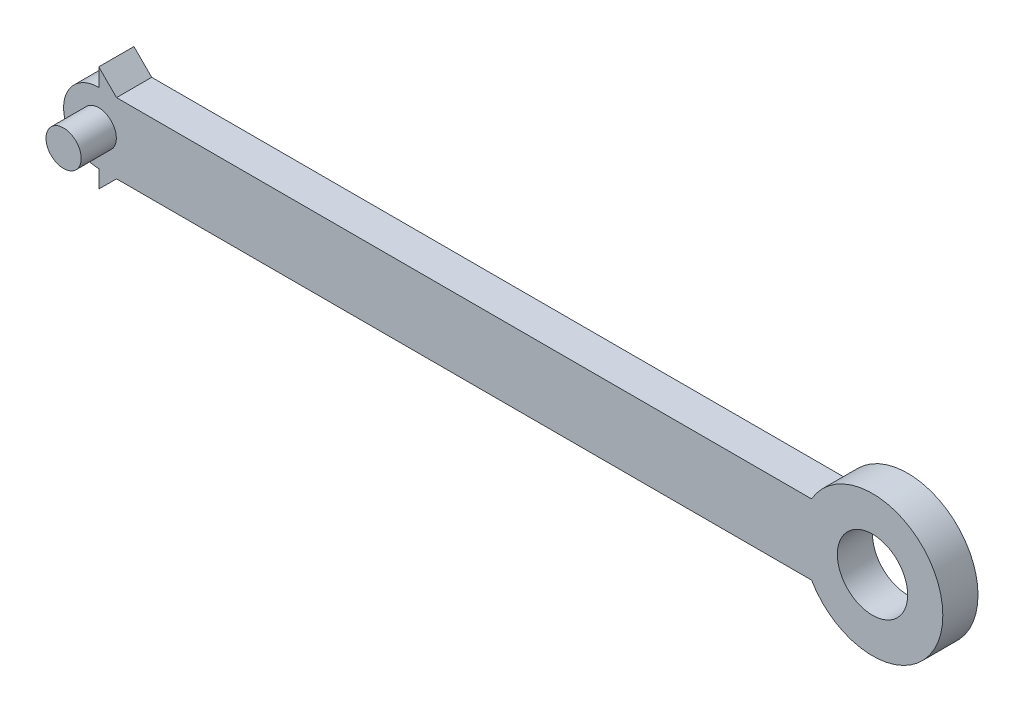
from build123d import *

# Parameters (mm, degrees)
BOSS_EXTRUDE1_DEPTH    = 20
SKETCH2_R              = 10
CUT_EXTRUDE1_DEPTH     = 20
SPUR_START             = 143.992112376
SPUR_GEAR_AM_OUTLINE_R = 5
SPUR_GEAR_AM_DEPTH     = 10
SKETCH4_R              = 40
BOSS_EXTRUDE2_DEPTH    = 20
BOSS_EXTRUDE3_DEPTH    = 20
SKETCH5_R              = 20
CUT_EXTRUDE4_DEPTH     = 20
BOSS_EXTRUDE4_START    = -40
SKETCH8_R              = 10
BOSS_EXTRUDE4_DEPTH    = 40


# Read off the part's stored shape, not the designer's step: spur gear_am
with BuildPart() as part:
    # Sketch1 → Boss-Extrude1 (new body)
    with BuildSketch(Plane.XY):
        with BuildLine():
            Line((-220, 20), (220, 20))
            ThreePointArc((220, 20), (240, 0), (220, -20))
            Line((220, -20), (-220, -20))
            ThreePointArc((-220, -20), (-240, 0), (-220, 20))
        make_face()
    extrude(amount=BOSS_EXTRUDE1_DEPTH)

    # Sketch2 → Cut-Extrude1 (cut)
    with BuildSketch(Plane.XY.offset(20)):
        with Locations((220, 0)):
            Circle(SKETCH2_R)
        with Locations((-220, 0)):
            Circle(SKETCH2_R)
    extrude(amount=-CUT_EXTRUDE1_DEPTH, mode=Mode.SUBTRACT)

    # Sketch4 → Boss-Extrude2 (add)
    with BuildSketch(Plane.XY.offset(20)):
        with Locations((220, 0)):
            Circle(SKETCH4_R)
    extrude(amount=-BOSS_EXTRUDE2_DEPTH)

    # Sketch6 → Boss-Extrude3 (add)
    with BuildSketch(Plane.XY.offset(20)):
        Polygon((-220, -20), (-220, -30.112160349), (-209.887839651, -20), align=None)
        Polygon((-209.887839651, 20), (-220, 20), (-220, 30.112160349), align=None)
    extrude(amount=-BOSS_EXTRUDE3_DEPTH)

    # Sketch5 → Cut-Extrude4 (cut)
    with BuildSketch(Plane(origin=(0, 0, 0), x_dir=(-1, 0, 0), z_dir=(0, 0, -1))):
        with Locations((-220, 0)):
            Circle(SKETCH5_R)
    extrude(amount=-CUT_EXTRUDE4_DEPTH, mode=Mode.SUBTRACT)

    # Sketch8 → Boss-Extrude4 (add)
    with BuildSketch(Plane(origin=(0, 0, 0), x_dir=(-1, 0, 0), z_dir=(0, 0, -1)).offset(BOSS_EXTRUDE4_START)):
        with Locations((220, 0)):
            Circle(SKETCH8_R)
    extrude(amount=BOSS_EXTRUDE4_DEPTH)


with BuildPart() as body_2:
    # spur gear_am outline → spur gear_am (new body)
    with BuildSketch(Plane.YZ.offset(SPUR_START)):
        with BuildLine():
            ThreePointArc((13.133221577, -371.123184299), (13.390101578, -371.125934087), (13.646981578, -371.123184299))
            ThreePointArc((13.646981578, -371.123184299), (14.846401327, -368.975865304), (14.562642986, -366.532697728))
            ThreePointArc((14.562642986, -366.532697728), (15.707420018, -366.257906902), (16.795082087, -365.807334294))
            ThreePointArc((16.795082087, -365.807334294), (18.001574637, -367.950687351), (20.234088035, -368.982903671))
            ThreePointArc((20.234088035, -368.982903671), (20.443524605, -368.834138019), (20.649728607, -368.680923118))
            ThreePointArc((20.649728607, -368.680923118), (20.35791713, -366.238704319), (18.69229394, -364.428929198))
            ThreePointArc((18.69229394, -364.428929198), (19.456920018, -363.533735693), (20.072017182, -362.529903073))
            ThreePointArc((20.072017182, -362.529903073), (22.307921476, -363.554753593), (24.720784284, -363.077595687))
            ThreePointArc((24.720784284, -363.077595687), (24.802779773, -362.834138019), (24.879544856, -362.588980889))
            ThreePointArc((24.879544856, -362.588980889), (23.207964219, -360.78470686), (20.796687626, -360.299596778))
            ThreePointArc((20.796687626, -360.299596778), (20.889101578, -359.125934087), (20.796687626, -357.952271396))
            ThreePointArc((20.796687626, -357.952271396), (23.207964219, -357.467161313), (24.879544856, -355.662887284))
            ThreePointArc((24.879544856, -355.662887284), (24.802779773, -355.417730154), (24.720784284, -355.174272487))
            ThreePointArc((24.720784284, -355.174272487), (22.307921476, -354.697114581), (20.072017182, -355.7219651))
            ThreePointArc((20.072017182, -355.7219651), (19.456920018, -354.71813248), (18.69229394, -353.822938975))
            ThreePointArc((18.69229394, -353.822938975), (20.35791713, -352.013163854), (20.649728607, -349.570945055))
            ThreePointArc((20.649728607, -349.570945055), (20.443524605, -349.417730154), (20.234088035, -349.268964503))
            ThreePointArc((20.234088035, -349.268964503), (18.001574638, -350.301180822), (16.795082087, -352.444533879))
            ThreePointArc((16.795082087, -352.444533879), (15.707420018, -351.993961271), (14.562642986, -351.719170445))
            ThreePointArc((14.562642986, -351.719170445), (14.846401327, -349.276002869), (13.646981578, -347.128683874))
            ThreePointArc((13.646981578, -347.128683874), (13.390101577, -347.125934087), (13.133221577, -347.128683874))
            ThreePointArc((13.133221577, -347.128683874), (11.933801828, -349.276002869), (12.217560169, -351.719170445))
            ThreePointArc((12.217560169, -351.719170445), (11.072783137, -351.993961271), (9.985121068, -352.444533879))
            ThreePointArc((9.985121068, -352.444533879), (8.778628518, -350.301180823), (6.546115121, -349.268964503))
            ThreePointArc((6.546115121, -349.268964503), (6.33667855, -349.417730154), (6.130474548, -349.570945055))
            ThreePointArc((6.130474548, -349.570945055), (6.422286026, -352.013163854), (8.087909215, -353.822938975))
            ThreePointArc((8.087909215, -353.822938975), (7.323283137, -354.71813248), (6.708185973, -355.7219651))
            ThreePointArc((6.708185973, -355.7219651), (4.472281679, -354.697114581), (2.059418871, -355.174272487))
            ThreePointArc((2.059418871, -355.174272487), (1.977423382, -355.417730154), (1.900658299, -355.662887284))
            ThreePointArc((1.900658299, -355.662887284), (3.572238937, -357.467161313), (5.98351553, -357.952271396))
            ThreePointArc((5.98351553, -357.952271396), (5.891101578, -359.125934087), (5.98351553, -360.299596778))
            ThreePointArc((5.98351553, -360.299596778), (3.572238937, -360.78470686), (1.900658299, -362.588980889))
            ThreePointArc((1.900658299, -362.588980889), (1.977423382, -362.834138019), (2.059418871, -363.077595687))
            ThreePointArc((2.059418871, -363.077595687), (4.472281679, -363.554753593), (6.708185973, -362.529903073))
            ThreePointArc((6.708185973, -362.529903073), (7.323283137, -363.533735693), (8.087909215, -364.428929198))
            ThreePointArc((8.087909215, -364.428929198), (6.422286026, -366.23870432), (6.130474548, -368.680923118))
            ThreePointArc((6.130474548, -368.680923118), (6.33667855, -368.834138019), (6.546115121, -368.982903671))
            ThreePointArc((6.546115121, -368.982903671), (8.778628518, -367.950687351), (9.985121068, -365.807334294))
            ThreePointArc((9.985121068, -365.807334294), (11.072783137, -366.257906902), (12.217560169, -366.532697728))
            ThreePointArc((12.217560169, -366.532697728), (11.933801828, -368.975865304), (13.133221577, -371.123184299))
        make_face()
        with Locations((13.390101578, -359.125934087)):
            Circle(SPUR_GEAR_AM_OUTLINE_R, mode=Mode.SUBTRACT)
    extrude(amount=SPUR_GEAR_AM_DEPTH)


solid = part.part
